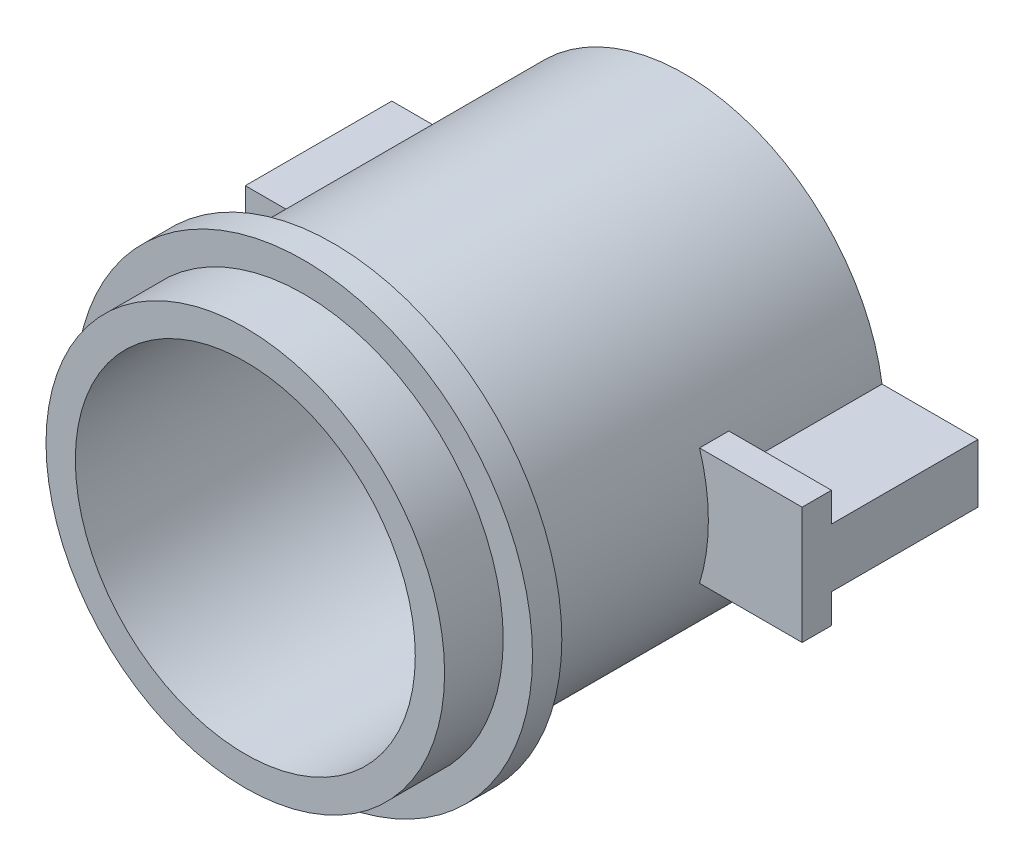
from build123d import *

# Parameters (mm, degrees)
ESQUISSE1_R             = 6.8
BOSS_EXTRU_1_DEPTH      = 15
COQUE1_T                = -1
ESQUISSE2_R             = 3.55
ENL_V_MAT_EXTRU_1_DEPTH = 15
CHANFREIN1_SIZE         = 3
BOSS_EXTRU_2_DEPTH      = 5
BOSS_EXTRU_3_DEPTH      = 1
BOSS_EXTRU_4_START      = -3
ESQUISSE5_R             = 7.8
ESQUISSE5_R_2           = 6.8
BOSS_EXTRU_4_DEPTH      = 1


with BuildPart() as part:
    # Esquisse1 → Boss.-Extru.1 (new body)
    with BuildSketch(Plane.XY):
        Circle(ESQUISSE1_R)
    extrude(amount=BOSS_EXTRU_1_DEPTH)

    # Coque1
    coque1_openings = [part.faces().sort_by_distance(p)[0] for p in [
        (0, 0, 15),
    ]]
    offset(amount=COQUE1_T, openings=coque1_openings, kind=Kind.INTERSECTION)

    # Esquisse2 → Enlèv. mat.-Extru.1 (cut)
    with BuildSketch(Plane(origin=(0, 0, 0), x_dir=(-1, 0, 0), z_dir=(0, 0, -1))):
        Circle(ESQUISSE2_R)
    extrude(amount=-ENL_V_MAT_EXTRU_1_DEPTH, mode=Mode.SUBTRACT)

    # Chanfrein1
    # the kernel refuses this chamfer: 3 mm, written as the material it adds along each edge
    with BuildSketch(Plane(origin=(0, 0, 1), x_dir=(1, 0, 0), z_dir=(0, 1, 0))) as chanfrein1_piece_1_section:
        Polygon((5.8, -CHANFREIN1_SIZE), (5.8 - CHANFREIN1_SIZE, 0), (5.8, 0), align=None)
    chanfrein1_piece_1 = revolve(axis=Axis((0, 0, 1), (0, 0, -1)), mode=Mode.PRIVATE)
    chanfrein1_piece_1 = chanfrein1_piece_1 - Plane(origin=(0, 0, 2.8805317), x_dir=(-1, 0, 0), z_dir=(0, 0, -1)) * Cylinder(3.55, 24, mode=Mode.PRIVATE)
    add(chanfrein1_piece_1)

    # Esquisse3 → Boss.-Extru.2 (add)
    with BuildSketch(Plane(origin=(0, 0, 0), x_dir=(-1, 0, 0), z_dir=(0, 0, -1))):
        with BuildLine():
            Line((-6.726068688, 1), (-10, 1))
            Line((-10, 1), (-10, -1))
            Line((-10, -1), (-6.726068688, -1))
            ThreePointArc((-6.726068688, -1), (-6.8, 0), (-6.726068688, 1))
        make_face()
        with BuildLine():
            Line((10, -1), (6.726068688, -1))
            ThreePointArc((6.726068688, -1), (6.8, 0), (6.726068688, 1))
            Line((6.726068688, 1), (10, 1))
            Line((10, 1), (10, -1))
        make_face()
    extrude(amount=-BOSS_EXTRU_2_DEPTH)

    # Esquisse4 → Boss.-Extru.3 (add)
    with BuildSketch(Plane.XY.offset(5)):
        with BuildLine():
            Line((10, 2), (10, -2))
            Line((10, -2), (6.499230724, -2))
            Line((6.499230724, -2), (5.444263036, -2))
            ThreePointArc((5.444263036, -2), (5.8, 0), (5.444263036, 2))
            Line((5.444263036, 2), (6.499230724, 2))
            Line((6.499230724, 2), (10, 2))
        make_face()
    extrude(amount=BOSS_EXTRU_3_DEPTH)

    # Esquisse5 → Boss.-Extru.4 (add)
    with BuildSketch(Plane.XY.offset(15).offset(BOSS_EXTRU_4_START)):
        Circle(ESQUISSE5_R)
        with Locations(Location((0, 0, 0), (0, 0, 171.543480665))):
            Circle(ESQUISSE5_R_2, mode=Mode.SUBTRACT)
    extrude(amount=BOSS_EXTRU_4_DEPTH)


solid = part.part
